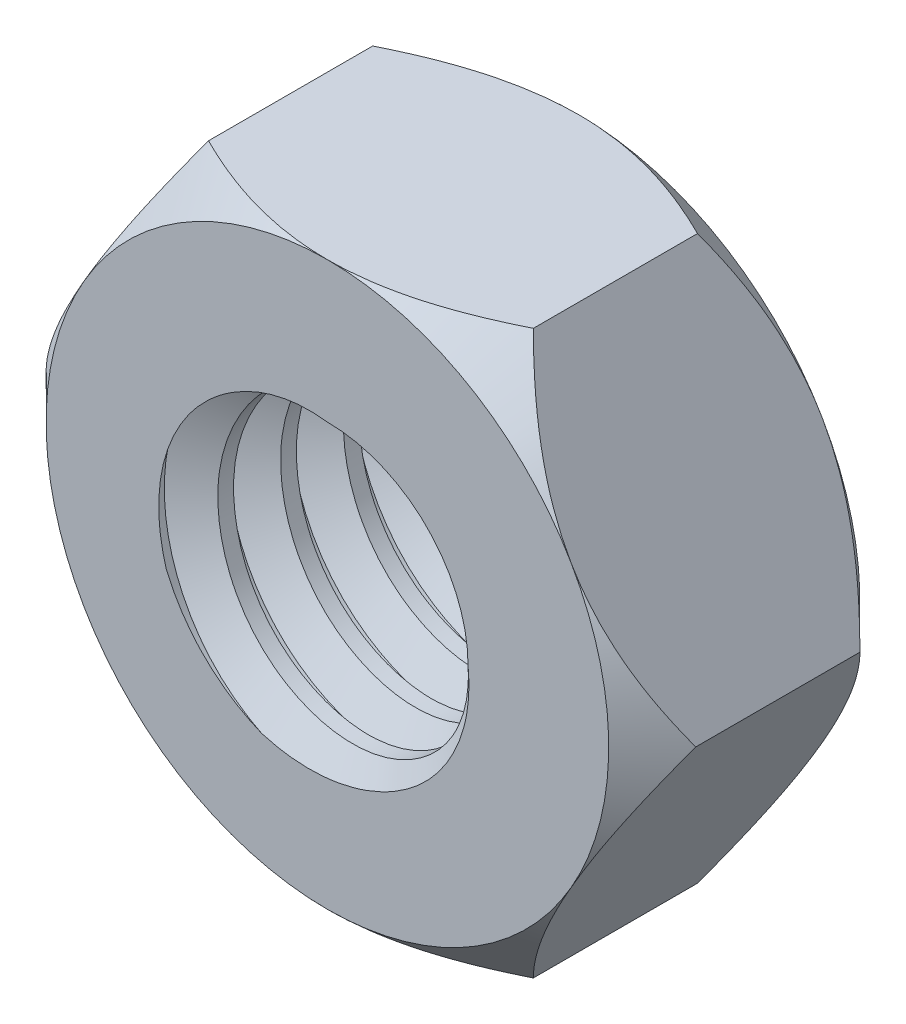
from build123d import *

# Parameters (mm, degrees)
BOSS_EXTRUDE1_DEPTH = 2.54
SKETCH4_R           = 1.4224
CUT_EXTRUDE1_DEPTH  = 43.444078266
THREAD1_PITCH       = 0.635
SKETCH10_OUTSIDE_W  = 15.46
SKETCH10_OUTSIDE_H  = 14.579
SKETCH10_OUTSIDE_R  = 2.8448
CUT_EXTRUDE2_DEPTH  = 2.54
CUT_EXTRUDE2_DRAFT  = -45
SKETCH11_OUTSIDE_W  = 15.46
SKETCH11_OUTSIDE_H  = 14.579
SKETCH11_OUTSIDE_R  = 2.8448
CUT_EXTRUDE3_DEPTH  = 2.54
CUT_EXTRUDE3_DRAFT  = -45


with BuildPart() as part:
    # Sketch1 → Boss-Extrude1 (new body)
    with BuildSketch(Plane.XY):
        Polygon((-26.837761031, 23.212523397), (-28.480207077, 26.057323397), (-31.765099168, 26.057323397), (-33.407545214, 23.212523397), (-31.765099168, 20.367723397), (-28.480207077, 20.367723397), align=None)
    extrude(amount=BOSS_EXTRUDE1_DEPTH)

    # Sketch4 → Cut-Extrude1 (cut, through all)
    with BuildSketch(Plane.XY.offset(2.54)):
        with Locations((-30.122653123, 23.212523397)):
            Circle(SKETCH4_R)
    extrude(amount=-CUT_EXTRUDE1_DEPTH, mode=Mode.SUBTRACT)

    # Thread1: the profile of Thread Profile1 profile screwed along a right-hand helix of 20 turns, 6 arcs to a turn; built about Z, then put on its axis
    thread1_z = Axis((0, 0, 0), (0, 0, 1))
    thread1_corners = [(1.4221, 0, -0.000173205), (1.766103831, 0, 0.198437499), (1.766103831, 0, 0.277812499), (1.4221, 0, 0.476423203)]
    with BuildLine(mode=Mode.PRIVATE) as thread1_profile:
        Line(thread1_corners[0], thread1_corners[1])
        Line(thread1_corners[1], thread1_corners[2])
        Line(thread1_corners[2], thread1_corners[3])
        Line(thread1_corners[3], thread1_corners[0])
    thread1_cap = Face(thread1_profile.wire())
    thread1_turn_angles = [0, 30, 60, 90, 120, 150, 180, 210, 240, 270, 300, 330, 360]
    thread1_turn_weights = [1, 0.8660254037844387, 1, 0.8660254037844387, 1, 0.8660254037844387, 1, 0.8660254037844387, 1, 0.8660254037844387, 1, 0.8660254037844387, 1]
    thread1_turn_rails = [Edge.make_bspline([Vector(p[0], p[1], 0).rotate(thread1_z, thread1_turn_angles[k]) / thread1_turn_weights[k] + Vector(0, 0, p[2] + THREAD1_PITCH * thread1_turn_angles[k] / 360) for k in range(13)], [0, 0, 0, 1, 1, 2, 2, 3, 3, 4, 4, 5, 5, 6, 6, 6], 2, thread1_turn_weights) for p in thread1_corners]
    thread1_turn_sides = [Face.make_surface_from_curves(thread1_turn_rails[p[0]], thread1_turn_rails[p[1]]) for p in [(0, 1), (1, 2), (2, 3), (3, 0)]]
    thread1 = Plane(origin=(-30.122653123, 23.212523397, -1.27), x_dir=(1, 0, 0), z_dir=(0, 0, 1)) * Solid(Shell([*[p.moved(Location((0, 0, THREAD1_PITCH * i))) for i in range(20) for p in thread1_turn_sides], thread1_cap, thread1_cap.rotate(thread1_z, 7200).moved(Location((0, 0, THREAD1_PITCH * 7200 / 360)))]))
    add(thread1, mode=Mode.SUBTRACT)


with BuildPart() as cut_extrude2_tool:
    # Sketch10 outside → Cut-Extrude2 (with draft: the straight prism first)
    with BuildSketch(Plane(origin=(0, 0, 0), x_dir=(-1, 0, 0), z_dir=(0, 0, -1))):
        with Locations((30.123, 23.2125)):
            Rectangle(SKETCH10_OUTSIDE_W, SKETCH10_OUTSIDE_H)
        with Locations((30.122653123, 23.212523397)):
            Circle(SKETCH10_OUTSIDE_R, mode=Mode.SUBTRACT)
    extrude(amount=-CUT_EXTRUDE2_DEPTH)
    # Cut-Extrude2: the draft: its side faces are tilted about the plane it starts from
    cut_extrude2_sides = [cut_extrude2_tool.faces().sort_by_distance(p)[0] for p in [
        (-30.123, 15.923, 1.27),
        (-37.853, 23.2125, 1.27),
        (-30.123, 30.502, 1.27),
        (-22.393, 23.2125, 1.27),
        (-27.277853123, 23.212523397, 1.27),
    ]]
    draft(cut_extrude2_sides, Plane(origin=(0, 0, 0), x_dir=(-1, 0, 0), z_dir=(0, 0, -1)), CUT_EXTRUDE2_DRAFT)


with BuildPart() as part_1:
    add(part.part)

    # Cut-Extrude2: cut by cut_extrude2_tool
    add(cut_extrude2_tool.part, mode=Mode.SUBTRACT)


with BuildPart() as cut_extrude3_tool:
    # Sketch11 outside → Cut-Extrude3 (with draft: the straight prism first)
    with BuildSketch(Plane.XY.offset(2.54)):
        with Locations((-30.123, 23.2125)):
            Rectangle(SKETCH11_OUTSIDE_W, SKETCH11_OUTSIDE_H)
        with Locations((-30.122653123, 23.212523397)):
            Circle(SKETCH11_OUTSIDE_R, mode=Mode.SUBTRACT)
    extrude(amount=-CUT_EXTRUDE3_DEPTH)
    # Cut-Extrude3: the draft: its side faces are tilted about the plane it starts from
    cut_extrude3_sides = [cut_extrude3_tool.faces().sort_by_distance(p)[0] for p in [
        (-30.123, 15.923, 1.27),
        (-22.393, 23.2125, 1.27),
        (-30.123, 30.502, 1.27),
        (-37.853, 23.2125, 1.27),
        (-32.967453123, 23.212523397, 1.27),
    ]]
    draft(cut_extrude3_sides, Plane.XY.offset(2.54), CUT_EXTRUDE3_DRAFT)


with BuildPart() as part_2:
    add(part_1.part)

    # Cut-Extrude3: cut by cut_extrude3_tool
    add(cut_extrude3_tool.part, mode=Mode.SUBTRACT)


solid = part_2.part
